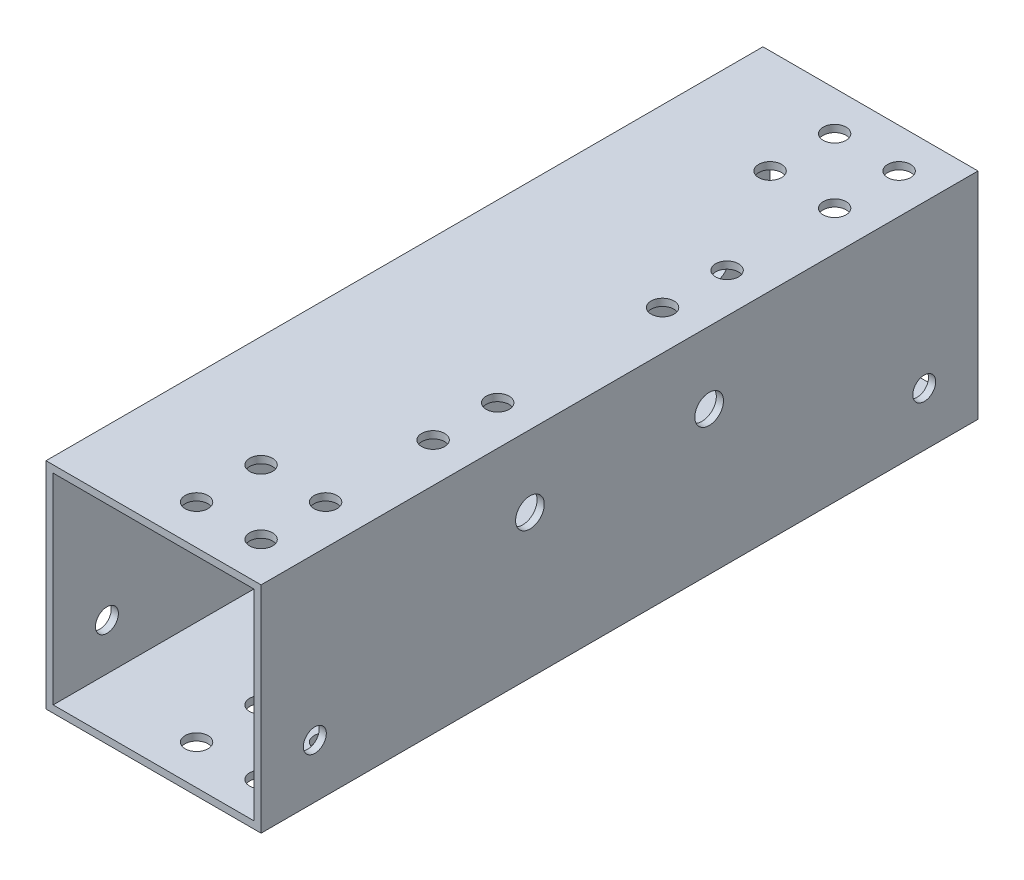
from build123d import *

# Parameters (mm, degrees)
SKETCH_1_W          = 30
SKETCH_1_H          = 30
SKETCH_1_W_2        = 28
SKETCH_1_H_2        = 28
EXTRUDE_1_DEPTH     = 100
SKETCH_3_R          = 1.6
CUT_EXTRUDE_1_DEPTH = 106.475115549
SKETCH_5_R          = 1.6
CUT_EXTRUDE_3_DEPTH = 106.475115549
SKETCH_6_R          = 2
CUT_EXTRUDE_4_DEPTH = 106.475115549


with BuildPart() as part:
    # 草图1 → 凸台-拉伸1 (new body)
    with BuildSketch(Plane.XY):
        Rectangle(SKETCH_1_W, SKETCH_1_H)
        Rectangle(SKETCH_1_W_2, SKETCH_1_H_2, mode=Mode.SUBTRACT)
    extrude(amount=EXTRUDE_1_DEPTH)

    # 草图3 → 切除-拉伸1 (cut, through all)
    with BuildSketch(Plane(origin=(0, 15, 0), x_dir=(1, 0, 0), z_dir=(0, 1, 0))):
        with Locations((0.5, -94.5)):
            Circle(SKETCH_3_R)
        with Locations((9.5, -94.5)):
            Circle(SKETCH_3_R)
        with Locations((9.5, -85.5)):
            Circle(SKETCH_3_R)
        with Locations((0.5, -85.5)):
            Circle(SKETCH_3_R)
        with Locations((9.5, -14.5)):
            Circle(SKETCH_3_R)
        with Locations((9.5, -5.5)):
            Circle(SKETCH_3_R)
        with Locations((0.5, -5.5)):
            Circle(SKETCH_3_R)
        with Locations((0.5, -14.5)):
            Circle(SKETCH_3_R)
        with Locations((9.5, -70.5)):
            Circle(SKETCH_3_R)
        with Locations((9.5, -61.5)):
            Circle(SKETCH_3_R)
        with Locations((9.5, -38.5)):
            Circle(SKETCH_3_R)
        with Locations((9.5, -29.5)):
            Circle(SKETCH_3_R)
    extrude(amount=-CUT_EXTRUDE_1_DEPTH, mode=Mode.SUBTRACT)

    # 草图5 → 切除-拉伸3 (cut, through all)
    with BuildSketch(Plane(origin=(15, 0, 0), x_dir=(0, 0, -1), z_dir=(1, 0, 0))):
        with Locations((-92.5, -7.5)):
            Circle(SKETCH_5_R)
        with Locations((-7.5, -7.5)):
            Circle(SKETCH_5_R)
    extrude(amount=-CUT_EXTRUDE_3_DEPTH, mode=Mode.SUBTRACT)

    # 草图6 → 切除-拉伸4 (cut, through all)
    with BuildSketch(Plane(origin=(15, 0, 0), x_dir=(0, 0, -1), z_dir=(1, 0, 0))):
        with Locations((-62.5, 5)):
            Circle(SKETCH_6_R)
        with Locations((-37.5, 5)):
            Circle(SKETCH_6_R)
    extrude(amount=-CUT_EXTRUDE_4_DEPTH, mode=Mode.SUBTRACT)


solid = part.part
